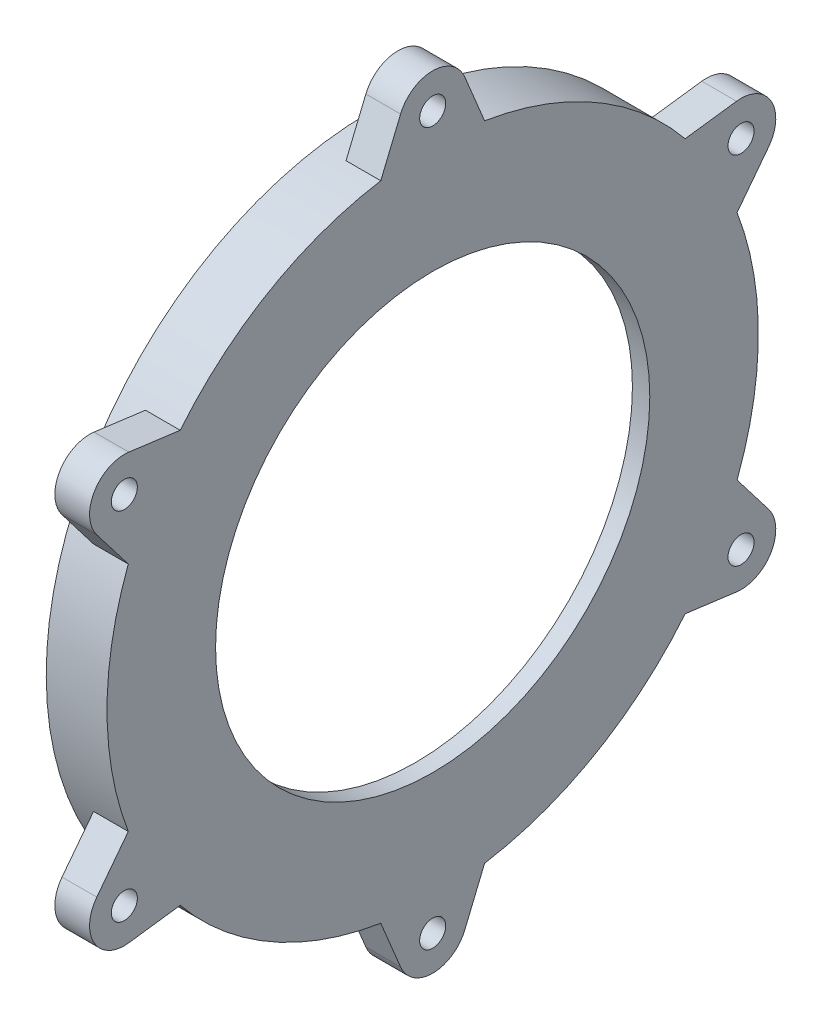
from build123d import *

# Parameters (mm, degrees)
BASPROSKE_W              = 5
BASPROSKE_H              = 2.2764
EXTRUDE_START            = 5
SKETCH_1_R               = 37.5
SKETCH_1_R_2             = 35.2764
EXTRUDE_1_DEPTH          = 5
SWEEP_1_PITCH            = 797.27
SWEEP_1_HEIGHT           = 10
SWEEP_1_RADIUS           = 33
TEETHCUTS_COUNT          = 68
TEETHCUTS_ANGLE          = 354.705882353
EXTRUDE_START_2          = 2
SKETCH_3_R               = 37.5
SKETCH_3_R_2             = 25
EXTRUDE_2_DEPTH          = 2
SKETCH_4_R               = 1.5
EXTRUDE_3_DEPTH          = 4
PATTERN_CIRCULAR_1_COUNT = 6


with BuildPart() as part:
    # BasProSke → Base-Revolve (revolve)
    with BuildSketch(Plane(origin=(0, 0, 0), x_dir=(1, 0, 0), z_dir=(0, 1, 0)), mode=Mode.PRIVATE) as base_revolve_sk:
        with Locations((2.5, 34.1382)):
            Rectangle(BASPROSKE_W, BASPROSKE_H)
    revolve(base_revolve_sk.sketch.rotate(Axis((-10, 0, 0), (1, 0, 0)), 180), axis=Axis((-10, 0, 0), (1, 0, 0)))

    # Эскиз1 → Бобышка-Вытянуть1 (add)
    with BuildSketch(Plane(origin=(0, 0, 0), x_dir=(0, 0, -1), z_dir=(1, 0, 0)).offset(EXTRUDE_START)):
        Circle(SKETCH_1_R)
        Circle(SKETCH_1_R_2, mode=Mode.SUBTRACT)
    extrude(amount=-EXTRUDE_1_DEPTH)

    # Вырез-По траектории1: sweep along a helix
    with BuildLine() as sweep_1_path:
        Helix(SWEEP_1_PITCH, SWEEP_1_HEIGHT, SWEEP_1_RADIUS, center=(0, 0, 0), direction=(1, 0, 0), lefthand=True)
    # TooCutSke<2> → Вырез-По траектории1 (sweep, cut)
    with BuildSketch(Plane(origin=(0, 0, 0), x_dir=(0, 0, -1), z_dir=(1, 0, 0))):
        with BuildLine():
            ThreePointArc((1.226521152, 32.951781303), (0.832509023, 34.116254131), (0.355375272, 35.249208635))
            ThreePointArc((0.355375272, 35.249208635), (0, 35.251), (-0.355375272, 35.249208635))
            ThreePointArc((-0.355375272, 35.249208635), (-0.832509023, 34.116254131), (-1.226521152, 32.951781303))
            ThreePointArc((-1.226521152, 32.951781303), (0, 32.9746), (1.226521152, 32.951781303))
        make_face()
    sweep_1 = sweep(path=sweep_1_path.line, is_frenet=True, mode=Mode.SUBTRACT)

    # TeethCuts: Вырез-По траектории1 ×68 about axis
    teethcuts_axis = Axis((-10, 0, 0), (1, 0, 0))
    for i in range(1, TEETHCUTS_COUNT):
        add(sweep_1.rotate(teethcuts_axis, i * TEETHCUTS_ANGLE / (TEETHCUTS_COUNT - 1)), mode=Mode.SUBTRACT)

    # Эскиз3 → Бобышка-Вытянуть2 (add)
    with BuildSketch(Plane(origin=(5, 0, 0), x_dir=(0, 0, -1), z_dir=(1, 0, 0)).offset(EXTRUDE_START_2)):
        Circle(SKETCH_3_R)
        Circle(SKETCH_3_R_2, mode=Mode.SUBTRACT)
    extrude(amount=-EXTRUDE_2_DEPTH)

    # Эскиз4 → Бобышка-Вытянуть3 (add)
    with BuildSketch(Plane(origin=(7, 0, 0), x_dir=(0, 0, -1), z_dir=(1, 0, 0))):
        with BuildLine():
            Line((-3.69551813, 42.530733729), (-5.977950182, 37.020455313))
            ThreePointArc((-5.977950182, 37.020455313), (0, 37.5), (5.977950182, 37.020455313))
            Line((5.977950182, 37.020455313), (3.69551813, 42.530733729))
            ThreePointArc((3.69551813, 42.530733729), (0, 45), (-3.69551813, 42.530733729))
        make_face()
        with Locations((0, 41)):
            Circle(SKETCH_4_R, mode=Mode.SUBTRACT)
    extrude_3 = extrude(amount=-EXTRUDE_3_DEPTH)

    # Круговой массив1: Бобышка-Вытянуть3 ×6 about axis
    pattern_circular_1_axis = Axis((0, 0, 0), (1, 0, 0))
    for i in range(1, PATTERN_CIRCULAR_1_COUNT):
        add(extrude_3.rotate(pattern_circular_1_axis, i * 360 / PATTERN_CIRCULAR_1_COUNT))


solid = part.part
